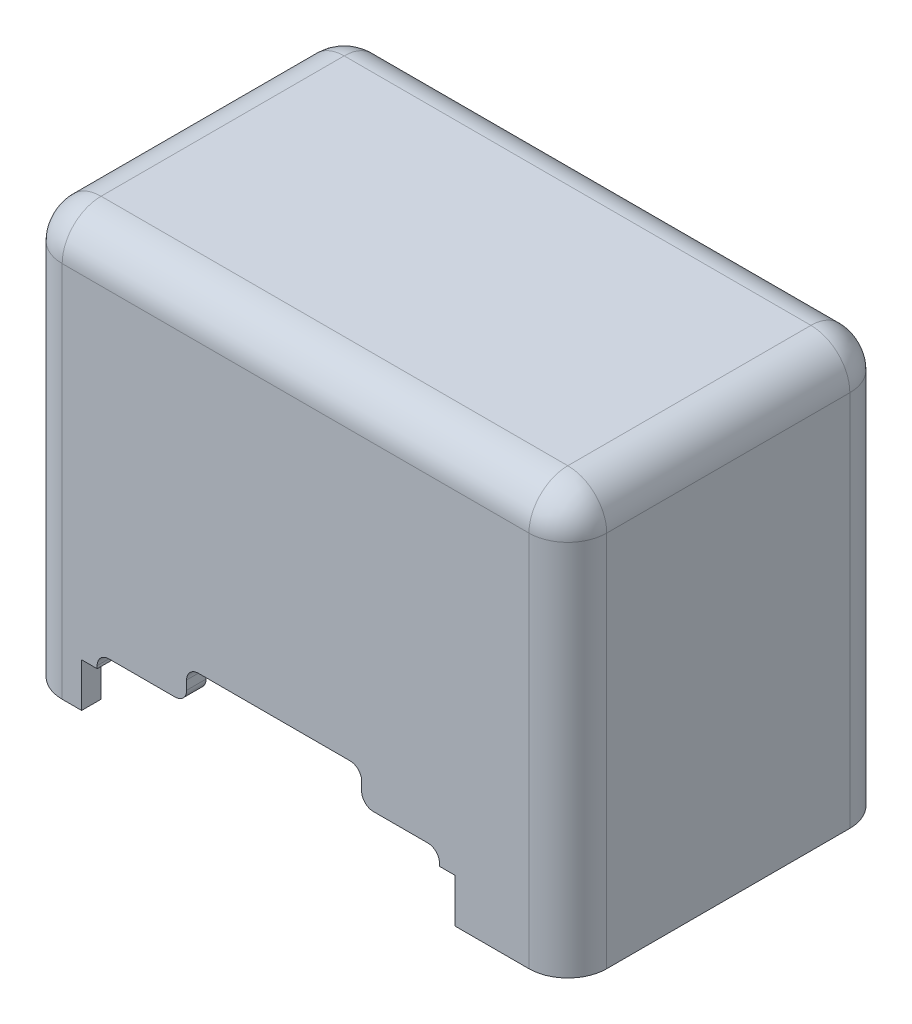
from build123d import *

# Parameters (mm, degrees)
SKETCH1_W           = 140
SKETCH1_H           = 82.5
SKETCH1_W_2         = 130
SKETCH1_H_2         = 72.5
BOSS_EXTRUDE1_DEPTH = 102
BOSS_EXTRUDE2_START = 102
SKETCH1_3_W         = 140
SKETCH1_3_H         = 82.5
BOSS_EXTRUDE2_DEPTH = 5
SKETCH1_4_W         = 96
SKETCH1_4_H         = 82.405729741
BOSS_EXTRUDE4_DEPTH = 11.3
SKETCH1_5_W         = 130
SKETCH1_5_H         = 10
EXTRUDE_THIN3_DEPTH = 15
CUT_EXTRUDE2_REACH  = 157.513
SKETCH2_W           = 88
SKETCH2_H           = 15
FILLET1_R           = 10
FILLET2_R           = 10
CUT_EXTRUDE3_REACH  = 186.296
SKETCH3_W           = 46.25
SKETCH3_H           = 75
FILLET3_R           = 10
CUT_EXTRUDE4_REACH  = 157.513
SKETCH4_W           = 45
SKETCH4_H           = 12
FILLET4_R           = 3


with BuildPart() as part:
    # Sketch1 → Boss-Extrude1 (new body)
    with BuildSketch(Plane(origin=(0, 0, 0), x_dir=(1, 0, 0), z_dir=(0, 1, 0))):
        with Locations((7, 12.75)):
            Rectangle(SKETCH1_W, SKETCH1_H)
        with Locations((7, 12.75)):
            Rectangle(SKETCH1_W_2, SKETCH1_H_2, mode=Mode.SUBTRACT)
    extrude(amount=BOSS_EXTRUDE1_DEPTH)

    # Sketch1<3> → Boss-Extrude2 (add)
    with BuildSketch(Plane(origin=(0, 0, 0), x_dir=(1, 0, 0), z_dir=(0, 1, 0)).offset(BOSS_EXTRUDE2_START)):
        with Locations((7, 12.75)):
            Rectangle(SKETCH1_3_W, SKETCH1_3_H)
    extrude(amount=BOSS_EXTRUDE2_DEPTH)

    # Sketch1<5> → Extrude-Thin3 (add)
    with BuildSketch(Plane(origin=(0, 0, 0), x_dir=(1, 0, 0), z_dir=(0, 1, 0))):
        with Locations((7, 44)):
            Rectangle(SKETCH1_5_W, SKETCH1_5_H)
    extrude(amount=EXTRUDE_THIN3_DEPTH)


with BuildPart() as body_2:
    # Sketch1<4> → Boss-Extrude4 (new body)
    with BuildSketch(Plane(origin=(0, 0, 0), x_dir=(1, 0, 0), z_dir=(0, 1, 0))):
        with Locations((0, 7.797135129)):
            Rectangle(SKETCH1_4_W, SKETCH1_4_H)
    extrude(amount=BOSS_EXTRUDE4_DEPTH)


with BuildPart() as part_1:
    add(part.part)

    # Combine1: cut body 2
    add(body_2.part, mode=Mode.SUBTRACT)

    # Sketch2 → Cut-Extrude2 (cut, up to next)
    with BuildSketch(Plane.XY.offset(28.5), mode=Mode.PRIVATE) as cut_extrude2_sk1:
        with Locations((0, 7.5)):
            Rectangle(SKETCH2_W, SKETCH2_H)
    cut_extrude2_tool1 = extrude(cut_extrude2_sk1.sketch, amount=-CUT_EXTRUDE2_REACH, mode=Mode.PRIVATE) & part_1.part
    add(cut_extrude2_tool1.solids().sort_by_distance((0, 7.5, 28.5))[0], mode=Mode.SUBTRACT)

    # Fillet1
    fillet1_edges = [part_1.edges().sort_by_distance(p)[0] for p in [
        (-58, 102, -12.75),
        (7, 102, 23.5),
        (72, 102, -12.75),
        (7, 102, -49),
        (7, 107, 28.5),
        (-63, 107, -12.75),
        (7, 107, -54),
        (77, 107, -12.75),
        (-58, 58.5, -49),
        (72, 58.5, -49),
        (72, 51, 23.5),
        (-58, 51, 23.5),
        (-63, 53.5, 28.5),
        (-63, 53.5, -54),
        (77, 53.5, -54),
        (77, 53.5, 28.5),
    ]]
    fillet(fillet1_edges, radius=FILLET1_R)

    # Fillet2
    fillet2_edges = [part_1.edges().sort_by_distance(p)[0] for p in [
        (7, 15, -49),
        (69.071067812, 15, -46.071067812),
        (-55.071067812, 15, -46.071067812),
    ]]
    fillet(fillet2_edges, radius=FILLET2_R - 0.0001)  # a hair under: the kernel refuses the full size

    # Sketch3 → Cut-Extrude3 (cut, up to next)
    with BuildSketch(Plane.ZY.offset(63), mode=Mode.PRIVATE) as cut_extrude3_sk1:
        with Locations((-4.625, 37.5)):
            Rectangle(SKETCH3_W, SKETCH3_H)
    cut_extrude3_tool1 = extrude(cut_extrude3_sk1.sketch, amount=-CUT_EXTRUDE3_REACH, mode=Mode.PRIVATE) & part_1.part
    add(cut_extrude3_tool1.solids().sort_by_distance((-63, 37.5, -4.625))[0], mode=Mode.SUBTRACT)

    # Fillet3
    fillet3_edges = [part_1.edges().sort_by_distance(p)[0] for p in [
        (-59.830127019, 75, 18.5),
        (-60.5, 75, -27.75),
    ]]
    fillet(fillet3_edges, radius=FILLET3_R)

    # Sketch4 → Cut-Extrude4 (cut, up to next)
    with BuildSketch(Plane.XY.offset(28.5), mode=Mode.PRIVATE) as cut_extrude4_sk1:
        with Locations((1.5, 17.3)):
            Rectangle(SKETCH4_W, SKETCH4_H)
    cut_extrude4_tool1 = extrude(cut_extrude4_sk1.sketch, amount=-CUT_EXTRUDE4_REACH, mode=Mode.PRIVATE) & part_1.part
    add(cut_extrude4_tool1.solids().sort_by_distance((1.5, 17.3, 28.5))[0], mode=Mode.SUBTRACT)

    # Fillet4
    fillet4_edges = [part_1.edges().sort_by_distance(p)[0] for p in [
        (44, 15, 26),
        (-44, 15, 26),
        (24, 15, 26),
        (24, 23.3, 26),
        (-21, 23.3, 26),
        (-21, 15, 26),
    ]]
    fillet(fillet4_edges, radius=FILLET4_R)


solid = part_1.part
